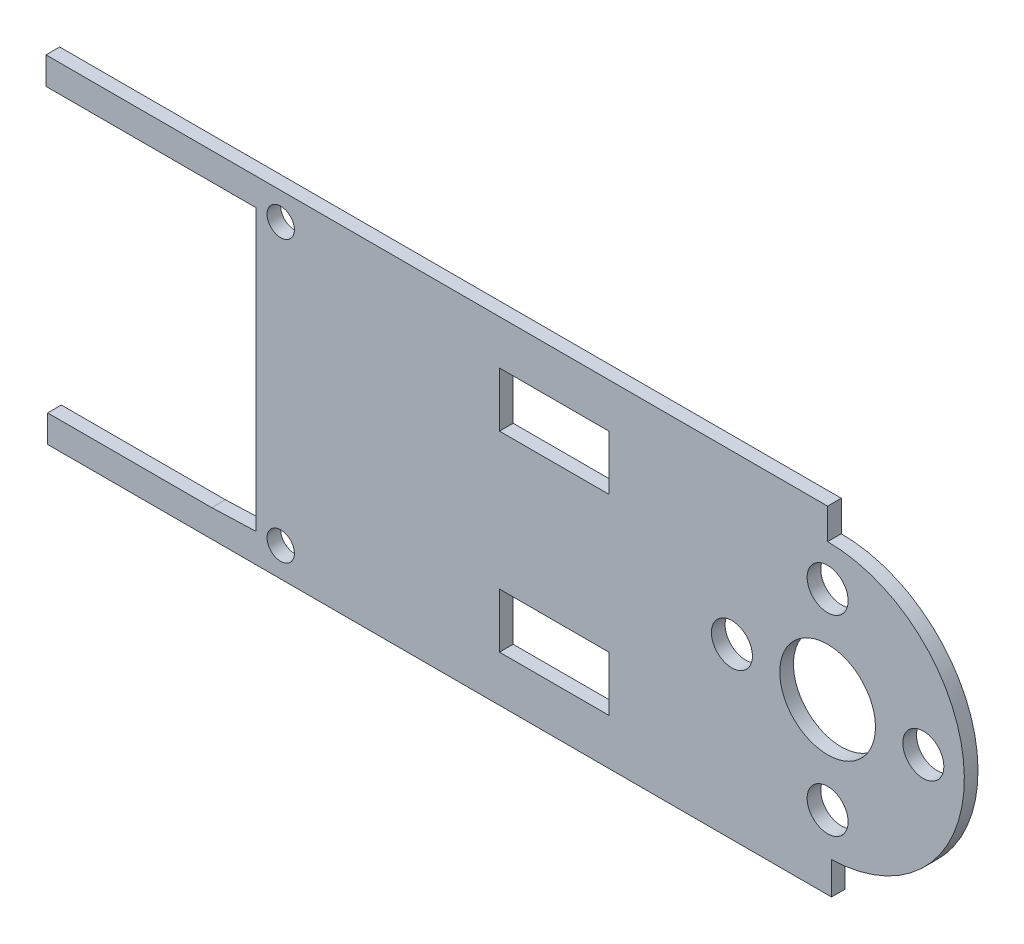
from build123d import *

# Parameters (mm, degrees)
SKETCH1_R           = 1
SKETCH1_R_2         = 1.5
SKETCH1_R_3         = 3.5
SKETCH1_W           = 8
SKETCH1_H           = 4
BOSS_EXTRUDE1_DEPTH = 1


with BuildPart() as part:
    # Sketch1 → Boss-Extrude1 (new body)
    with BuildSketch(Plane.XY):
        with BuildLine():
            Line((-5.166471095, 12.25), (-17.166471095, 12.25))
            Line((-17.166471095, 12.25), (-17.166471095, 10.25))
            Line((-17.166471095, 10.25), (-5.048221431, 10.25))
            Line((-5.048221431, 10.25), (-1.798221431, 10.25))
            Line((-1.798221431, 10.25), (-1.798221431, -10.25))
            Line((-1.798221431, -10.25), (-5.048221431, -10.368142505))
            Line((-5.048221431, -10.368142505), (-17.048221431, -10.368142505))
            Line((-17.048221431, -10.368142505), (-17.048221431, -12.368142505))
            Line((-17.048221431, -12.368142505), (-5.048221431, -12.368142505))
            Line((-5.048221431, -12.368142505), (5.21629802, -12.368142505))
            Line((5.21629802, -12.368142505), (40.284720759, -12.368142505))
            Line((40.284720759, -12.368142505), (40.284720759, -9.995945883))
            ThreePointArc((40.284720759, -9.995945883), (49.998986419, 0.142374811), (40, 10))
            Line((40, 10), (40, 12.25))
            Line((40, 12.25), (5, 12.25))
            Line((5, 12.25), (-5.166471095, 12.25))
        make_face()
        with Locations((0, 10.25)):
            Circle(SKETCH1_R, mode=Mode.SUBTRACT)
        with Locations((0, -10.25)):
            Circle(SKETCH1_R, mode=Mode.SUBTRACT)
        with Locations((40, 7)):
            Circle(SKETCH1_R_2, mode=Mode.SUBTRACT)
        with Locations((47, 0)):
            Circle(SKETCH1_R_2, mode=Mode.SUBTRACT)
        with Locations((40, -7)):
            Circle(SKETCH1_R_2, mode=Mode.SUBTRACT)
        with Locations((33, 0)):
            Circle(SKETCH1_R_2, mode=Mode.SUBTRACT)
        with Locations((40, 0)):
            Circle(SKETCH1_R_3, mode=Mode.SUBTRACT)
        with Locations((20, 7)):
            Rectangle(SKETCH1_W, SKETCH1_H, mode=Mode.SUBTRACT)
        with Locations((20, -7)):
            Rectangle(SKETCH1_W, SKETCH1_H, mode=Mode.SUBTRACT)
    extrude(amount=BOSS_EXTRUDE1_DEPTH)


solid = part.part
